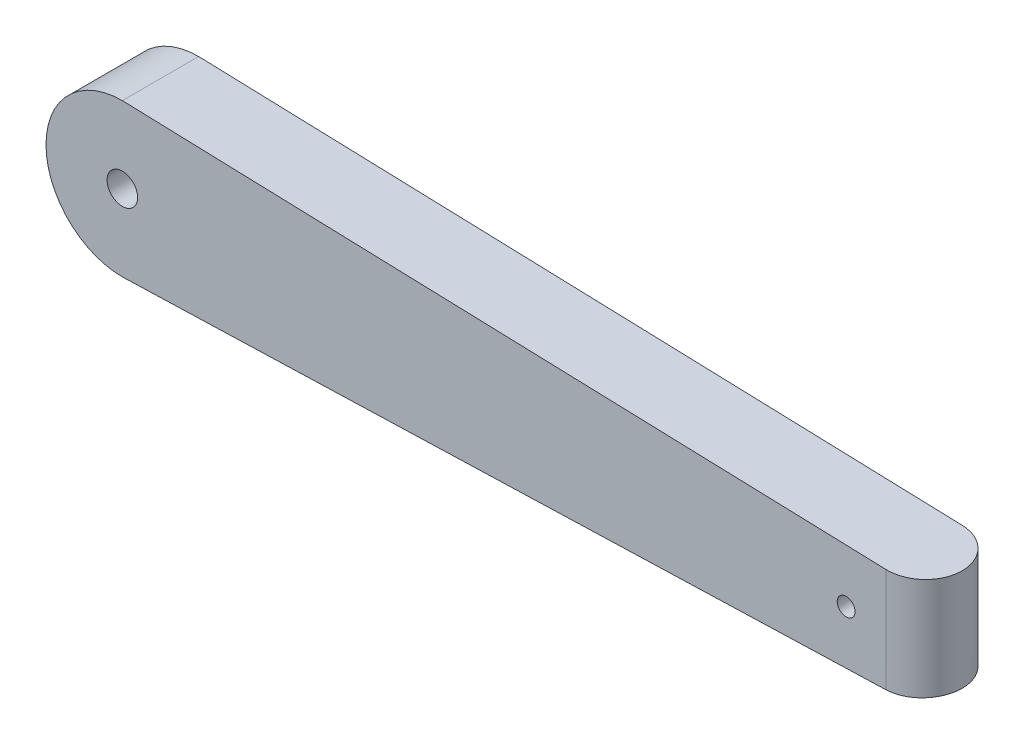
from build123d import *

# Parameters (mm, degrees)
BOSS_EXTRUDE2_DEPTH = 15
FILLET4_START       = -11
FILLET4_DEPTH       = 22
SKETCH2_R           = 1.75
CUT_EXTRUDE1_DEPTH  = 32
SKETCH3_R           = 3
CUT_EXTRUDE2_DEPTH  = 47


with BuildPart() as part:
    # Sketch1 → Boss-Extrude2 (new body)
    with BuildSketch(Plane.XY):
        with BuildLine():
            Line((157.5, -10), (157.5, 10))
            Line((157.5, 10), (0, 15))
            ThreePointArc((0, 15), (-15, 0), (0, -15))
            Line((0, -15), (157.5, -10))
        make_face()
    extrude(amount=BOSS_EXTRUDE2_DEPTH)

    # Fillet4: read off the stored shape, not the designer's step
    # Fillet4 outline → Fillet4 (cut)
    with BuildSketch(Plane(origin=(0, 0, 0), x_dir=(1, 0, 0), z_dir=(0, 1, 0)).offset(FILLET4_START)):
        with BuildLine():
            ThreePointArc((150, 0), (155.303300859, -2.196699141), (157.5, -7.5))
            Line((157.5, -7.5), (157.5, 0))
            Line((157.5, 0), (150, 0))
        make_face()
        with BuildLine():
            ThreePointArc((157.5, -7.5), (155.303300859, -12.803300859), (150, -15))
            Line((150, -15), (157.5, -15))
            Line((157.5, -15), (157.5, -7.5))
        make_face()
    extrude(amount=FILLET4_DEPTH, mode=Mode.SUBTRACT)

    # Sketch2 → Cut-Extrude1 (cut)
    with BuildSketch(Plane.XY.offset(15)):
        with Locations((142.197100849, 0)):
            Circle(SKETCH2_R)
    extrude(amount=-CUT_EXTRUDE1_DEPTH, mode=Mode.SUBTRACT)

    # Sketch3 → Cut-Extrude2 (cut)
    with BuildSketch(Plane.XY.offset(15)):
        Circle(SKETCH3_R)
    extrude(amount=-CUT_EXTRUDE2_DEPTH, mode=Mode.SUBTRACT)


solid = part.part
